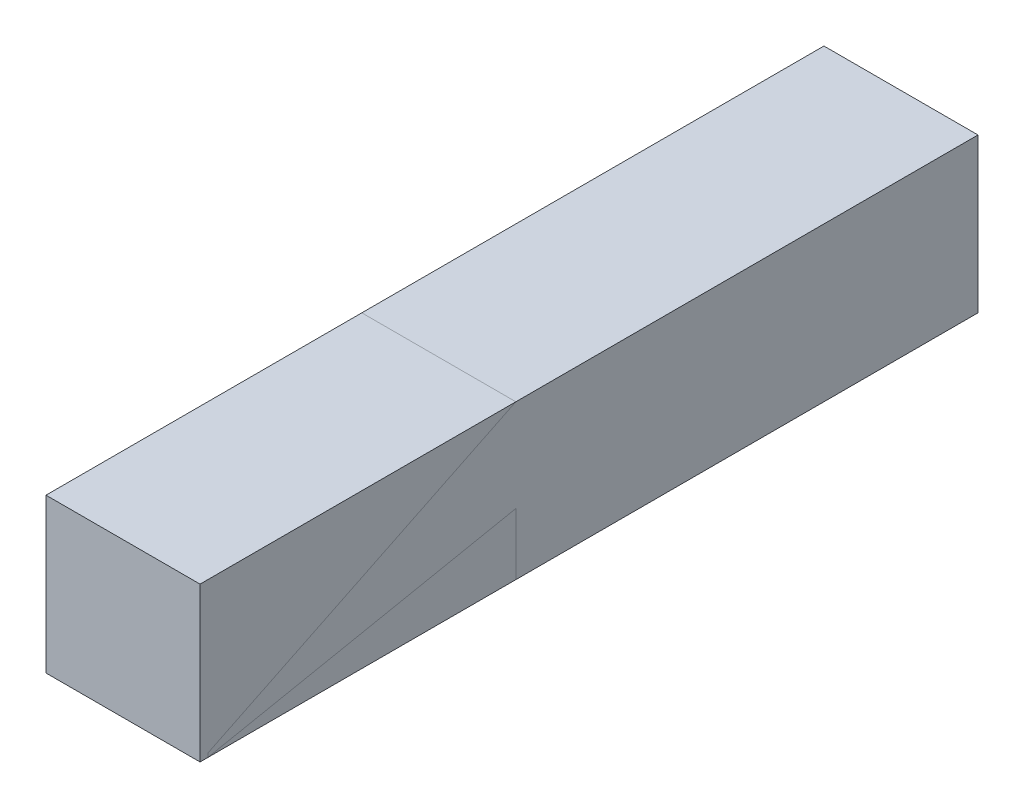
from build123d import *

# Parameters (mm, degrees)
SKETCH1_W                = 44.45
SKETCH1_H                = 19.05
BOSS_EXTRUDE1_DEPTH      = 9.525
SKETCH20_W               = 127
SKETCH20_H               = 25.4
BOSS_EXTRUDE3_DEPTH      = 25.4
CUT_EXTRUDE3_DEPTH       = 108.134568436
CUT_EXTRUDE3_DEPTH_BACK  = 108.134568436
SKETCH2_OUTSIDE_W        = 155.396
SKETCH2_OUTSIDE_H        = 53.796
SKETCH7_R                = 6.604
CUT_EXTRUDE6_DEPTH       = 6.477
SKETCH11_R               = 6.604
CUT_EXTRUDE10_DEPTH      = 1.6764
SKETCH8_R                = 6.604
CUT_EXTRUDE7_DEPTH       = 3.556
CUT_EXTRUDE8_START       = -3.556
SKETCH9_R                = 6.604
CUT_EXTRUDE8_DEPTH       = 3.556
CUT_EXTRUDE9_DEPTH       = 108.134568436
CUT_EXTRUDE9_DEPTH_BACK  = 108.134568436
SKETCH10_R               = 1.5875
SKETCH10_R_2             = 3.175
CUT_EXTRUDE11_DEPTH      = 108.134568436
CUT_EXTRUDE11_DEPTH_BACK = 108.134568436
SKETCH12_W               = 3.3528
SKETCH12_H               = 6.477
CUT_EXTRUDE12_DEPTH      = 108.134568436
CUT_EXTRUDE12_DEPTH_BACK = 108.134568436
SKETCH13_R               = 0.79375
SKETCH13_W               = 12.284827435
SKETCH13_H               = 3.3528
CUT_EXTRUDE13_DEPTH      = 1.5875
CUT_EXTRUDE14_DEPTH      = 108.134568436
CUT_EXTRUDE14_DEPTH_BACK = 108.134568436
SKETCH16_R               = 0.79375
FILLET1_R                = 3.175
CUT_EXTRUDE15_DEPTH      = 108.134568436
CUT_EXTRUDE15_DEPTH_BACK = 108.134568436
SKETCH17_W               = 3.3528
SKETCH17_H               = 3.175
SKETCH18_R               = 6.604
CUT_EXTRUDE16_DEPTH      = 2.667
SKETCH19_W               = 44.45
SKETCH19_H               = 19.05
BOSS_EXTRUDE2_DEPTH      = 19.05
CUT_EXTRUDE17_DEPTH      = 108.134568436
CUT_EXTRUDE17_DEPTH_BACK = 108.134568436
SKETCH25_W               = 3.3528
SKETCH25_H               = 2.606010696
SKETCH25_H_2             = 3.239796566
SKETCH31_W               = 52.07
SKETCH31_H               = 25.4
BOSS_EXTRUDE5_DEPTH      = 25.4
CUT_EXTRUDE20_DEPTH      = 108.172199087
CUT_EXTRUDE20_DEPTH_BACK = 12.954
CUT_EXTRUDE21_DEPTH      = 99.086844913
CUT_EXTRUDE21_DEPTH_BACK = 0.79375
SKETCH36_W               = 12.954
SKETCH36_H               = 31.048348725


with BuildPart() as part:
    # Sketch1 → Boss-Extrude1 (new, symmetric)
    with BuildSketch(Plane(origin=(0, 0, 0), x_dir=(0, 0, -1), z_dir=(1, 0, 0))):
        with Locations((0, 0.127)):
            Rectangle(SKETCH1_W, SKETCH1_H)
    extrude(amount=BOSS_EXTRUDE1_DEPTH, both=True)

    # Sketch2 outside → Cut-Extrude3 (cut, two sides: drawn at the far end of the back side and taken through both)
    with BuildSketch(Plane(origin=(0, 0, 0), x_dir=(0, 0, -1), z_dir=(1, 0, 0)).offset(-CUT_EXTRUDE3_DEPTH_BACK)):
        with Locations((41.275, -3.048)):
            Rectangle(SKETCH2_OUTSIDE_W, SKETCH2_OUTSIDE_H)
        with BuildLine():
            Line((-11.384871939, -4.490128061), (-6.477, -9.398))
            Line((-6.477, -9.398), (6.477, -9.398))
            Line((6.477, -9.398), (11.384871939, -4.490128061))
            ThreePointArc((11.384871939, -4.490128061), (22.102986531, -1.238823545), (13.444960204, 5.866635031))
            Line((13.444960204, 5.866635031), (11.877010696, 9.652))
            Line((11.877010696, 9.652), (-15.875, 9.652))
            Line((-15.875, 9.652), (-15.875, 6.35))
            ThreePointArc((-15.875, 6.35), (-21.741635031, -2.430039796), (-11.384871939, -4.490128061))
        make_face(mode=Mode.SUBTRACT)
    extrude(amount=CUT_EXTRUDE3_DEPTH + CUT_EXTRUDE3_DEPTH_BACK, mode=Mode.SUBTRACT)

    # Sketch7 → Cut-Extrude6 (cut, symmetric)
    with BuildSketch(Plane(origin=(0, 0, 0), x_dir=(0, 0, -1), z_dir=(1, 0, 0))):
        with Locations((15.875, 0)):
            Circle(SKETCH7_R)
    extrude(amount=CUT_EXTRUDE6_DEPTH, both=True, mode=Mode.SUBTRACT)

    # Sketch11 → Cut-Extrude10 (cut, symmetric)
    with BuildSketch(Plane(origin=(0, 0, 0), x_dir=(0, 0, -1), z_dir=(1, 0, 0))):
        with Locations((-15.875, 0)):
            Circle(SKETCH11_R)
    extrude(amount=CUT_EXTRUDE10_DEPTH, both=True, mode=Mode.SUBTRACT)

    # Sketch8 → Cut-Extrude7 (cut)
    with BuildSketch(Plane(origin=(9.525, 0, 0), x_dir=(0, 0, -1), z_dir=(1, 0, 0))):
        with Locations((-15.875, 0)):
            Circle(SKETCH8_R)
    extrude(amount=-CUT_EXTRUDE7_DEPTH, mode=Mode.SUBTRACT)

    # Sketch9 → Cut-Extrude8 (cut)
    with BuildSketch(Plane.ZY.offset(9.525).offset(CUT_EXTRUDE8_START)):
        with Locations((15.875, 0)):
            Circle(SKETCH9_R)
    extrude(amount=CUT_EXTRUDE8_DEPTH, mode=Mode.SUBTRACT)

    # Sketch10 → Cut-Extrude9 (cut, two sides: drawn at the far end of the back side and taken through both)
    with BuildSketch(Plane(origin=(0, 0, 0), x_dir=(0, 0, -1), z_dir=(1, 0, 0)).offset(-CUT_EXTRUDE9_DEPTH_BACK)):
        with Locations((-15.875, 0)):
            Circle(SKETCH10_R)
        with Locations((15.875, 0)):
            Circle(SKETCH10_R_2)
    extrude(amount=CUT_EXTRUDE9_DEPTH + CUT_EXTRUDE9_DEPTH_BACK, mode=Mode.SUBTRACT)

    # Sketch12 → Cut-Extrude11 (cut, two sides: drawn at the far end of the back side and taken through both)
    with BuildSketch(Plane.XY.offset(-CUT_EXTRUDE11_DEPTH_BACK)):
        with Locations((0, 6.4135)):
            Rectangle(SKETCH12_W, SKETCH12_H)
    extrude(amount=CUT_EXTRUDE11_DEPTH + CUT_EXTRUDE11_DEPTH_BACK, mode=Mode.SUBTRACT)

    # Sketch13 → Cut-Extrude12 (cut, two sides: drawn at the far end of the back side and taken through both)
    with BuildSketch(Plane(origin=(0, 0, 0), x_dir=(0, 0, -1), z_dir=(1, 0, 0)).offset(-CUT_EXTRUDE12_DEPTH_BACK)):
        with Locations((-7.66279023, 4.7625)):
            Circle(SKETCH13_R)
        with Locations((-0.080586283, 4.7625)):
            Rectangle(SKETCH13_W, SKETCH13_H)
    extrude(amount=CUT_EXTRUDE12_DEPTH + CUT_EXTRUDE12_DEPTH_BACK, mode=Mode.SUBTRACT)

    # Sketch14 → Cut-Extrude13 (cut, symmetric)
    with BuildSketch(Plane(origin=(0, 0, 0), x_dir=(0, 0, -1), z_dir=(1, 0, 0))):
        Polygon((-9.525, -6.35), (-6.477, -9.398), (6.477, -9.398), (9.525, -6.35), align=None)
    extrude(amount=CUT_EXTRUDE13_DEPTH, both=True, mode=Mode.SUBTRACT)

    # Sketch16 → Cut-Extrude14 (cut, two sides: drawn at the far end of the back side and taken through both)
    with BuildSketch(Plane(origin=(0, 0, 0), x_dir=(0, 0, -1), z_dir=(1, 0, 0)).offset(-CUT_EXTRUDE14_DEPTH_BACK)):
        with Locations((-6.477, -7.9375)):
            Circle(SKETCH16_R)
        with Locations((6.477, -7.9375)):
            Circle(SKETCH16_R)
    extrude(amount=CUT_EXTRUDE14_DEPTH + CUT_EXTRUDE14_DEPTH_BACK, mode=Mode.SUBTRACT)

    # Fillet1
    # the kernel refuses this fillet: 3.175 mm, written as the material it takes off along each edge
    with BuildSketch(Plane(origin=(-9.525, -9.398, -14.4145), x_dir=(0, 1, 0), z_dir=(0, 0, 1)), Plane(origin=(9.525, -9.398, -14.4145), x_dir=(-1, 0, 0), z_dir=(0, 0, 1))) as fillet1_piece_1:
        with BuildLine():
            CenterArc((FILLET1_R, -FILLET1_R), FILLET1_R, 90, 90)
            Line((0, -FILLET1_R), (0, 0))
            Line((0, 0), (FILLET1_R, 0))
        make_face()
    extrude(amount=28.829, mode=Mode.SUBTRACT)
    with BuildSketch(Plane(origin=(-9.525, 9.652, 23.8125), x_dir=(1, 0, 0), z_dir=(0, 0, -1)), Plane(origin=(9.525, 9.652, 23.8125), x_dir=(0, -1, 0), z_dir=(0, 0, -1))) as fillet1_piece_2:
        with BuildLine():
            CenterArc((FILLET1_R, FILLET1_R), FILLET1_R, 180, 90)
            Line((0, FILLET1_R), (0, 0))
            Line((0, 0), (FILLET1_R, 0))
        make_face()
    extrude(amount=43.627010696, mode=Mode.SUBTRACT)

    # Sketch17 → Cut-Extrude15 (cut, two sides: drawn at the far end of the back side and taken through both)
    with BuildSketch(Plane.XY.offset(-CUT_EXTRUDE15_DEPTH_BACK)):
        with Locations((0, 1.5875)):
            Rectangle(SKETCH17_W, SKETCH17_H)
    extrude(amount=CUT_EXTRUDE15_DEPTH + CUT_EXTRUDE15_DEPTH_BACK, mode=Mode.SUBTRACT)

    # Sketch18 → Cut-Extrude16 (cut, symmetric)
    with BuildSketch(Plane(origin=(0, 0, 0), x_dir=(0, 0, -1), z_dir=(1, 0, 0))):
        with Locations((-15.875, 0)):
            Circle(SKETCH18_R)
    extrude(amount=CUT_EXTRUDE16_DEPTH, both=True, mode=Mode.SUBTRACT)

    # Sketch25 → Cut-Extrude17 (cut, two sides: drawn at the far end of the back side and taken through both)
    with BuildSketch(Plane(origin=(0, 0, 0), x_dir=(1, 0, 0), z_dir=(0, 1, 0)).offset(-CUT_EXTRUDE17_DEPTH_BACK)):
        with Locations((0, 10.574005348)):
            Rectangle(SKETCH25_W, SKETCH25_H)
        with Locations((0, -10.890898283)):
            Rectangle(SKETCH25_W, SKETCH25_H_2)
    extrude(amount=CUT_EXTRUDE17_DEPTH + CUT_EXTRUDE17_DEPTH_BACK, mode=Mode.SUBTRACT)

    # Sketch35 → Cut-Extrude20 (cut, two sides: drawn at the far end of the back side and taken through both)
    with BuildSketch(Plane.XZ.offset(6.35).offset(-CUT_EXTRUDE20_DEPTH_BACK)):
        Polygon((-2.667, 9.271), (-2.667, 16.964700168), (2.667, 16.964700168), (2.667, 9.271), (2.667, 8.47725), (-2.667, 8.47725), align=None)
    extrude(amount=CUT_EXTRUDE20_DEPTH + CUT_EXTRUDE20_DEPTH_BACK, mode=Mode.SUBTRACT)

    # Sketch36 → Cut-Extrude21 (cut, two sides: drawn at the far end of the back side and taken through both)
    with BuildSketch(Plane(origin=(0, 0, -9.271), x_dir=(-1, 0, 0), z_dir=(0, 0, -1)).offset(-CUT_EXTRUDE21_DEPTH_BACK)):
        with Locations((0, -9.422873929)):
            Rectangle(SKETCH36_W, SKETCH36_H)
    extrude(amount=CUT_EXTRUDE21_DEPTH + CUT_EXTRUDE21_DEPTH_BACK, mode=Mode.SUBTRACT)


with BuildPart() as body_2:
    # Sketch20 → Boss-Extrude3 (new body)
    with BuildSketch(Plane.ZY.offset(9.525)):
        with Locations((-41.275, -3.048)):
            Rectangle(SKETCH20_W, SKETCH20_H)
    extrude(amount=-BOSS_EXTRUDE3_DEPTH)


with BuildPart() as body_3:
    # Sketch19 → Boss-Extrude2 (new, through all)
    with BuildSketch(Plane(origin=(9.525, 0, 0), x_dir=(0, 0, -1), z_dir=(1, 0, 0))):
        with Locations((0, 0.127)):
            Rectangle(SKETCH19_W, SKETCH19_H)
    extrude(amount=-BOSS_EXTRUDE2_DEPTH)


with BuildPart() as body_4:
    # Sketch31 → Boss-Extrude5 (new body)
    with BuildSketch(Plane.ZY.offset(9.525)):
        with Locations((-2.54, -3.048)):
            Rectangle(SKETCH31_W, SKETCH31_H)
    extrude(amount=-BOSS_EXTRUDE5_DEPTH)


solid = Compound([part.part, body_2.part, body_3.part, body_4.part])
